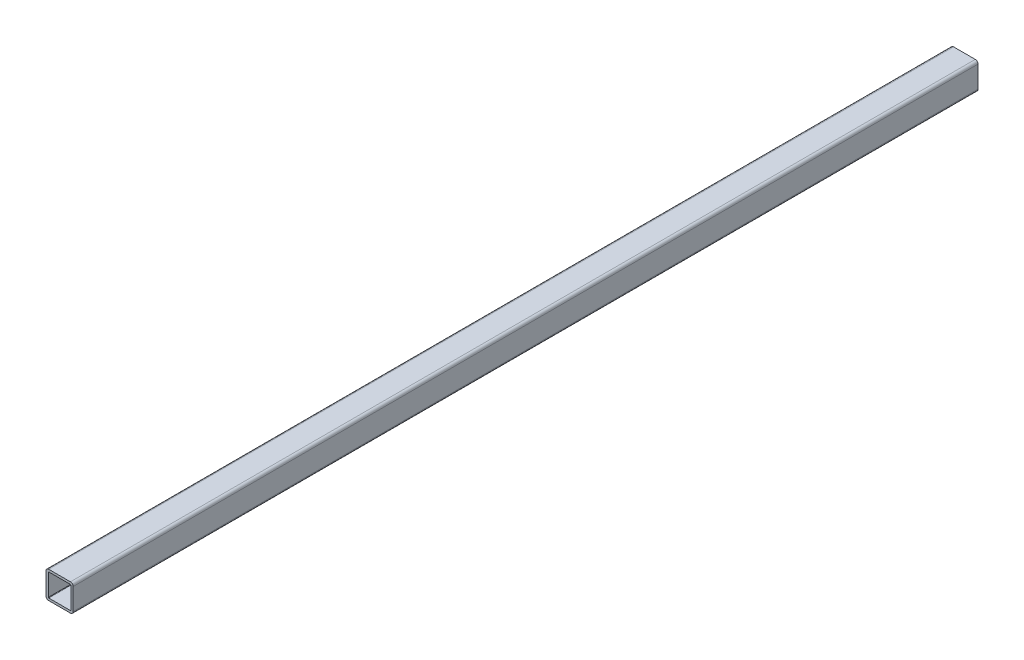
from build123d import *

# Parameters (mm, degrees)
SKETCH2_W           = 19.05
SKETCH2_H           = 19.05
SKETCH2_W_2         = 15.875
SKETCH2_H_2         = 15.875
BOSS_EXTRUDE1_DEPTH = 317.5
FILLET1_R           = 1.905
FILLET2_R           = 0.3175


with BuildPart() as part:
    # Sketch2 → Boss-Extrude1 (new, symmetric)
    with BuildSketch(Plane.XY):
        Rectangle(SKETCH2_W, SKETCH2_H)
        Rectangle(SKETCH2_W_2, SKETCH2_H_2, mode=Mode.SUBTRACT)
    extrude(amount=BOSS_EXTRUDE1_DEPTH, both=True)

    # Fillet1
    fillet1_edges = [part.edges().sort_by_distance(p)[0] for p in [
        (-9.525, -9.525, 0),
        (-9.525, 9.525, 0),
        (9.525, -9.525, 0),
        (9.525, 9.525, 0),
    ]]
    fillet(fillet1_edges, radius=FILLET1_R)

    # Fillet2
    fillet2_edges = [part.edges().sort_by_distance(p)[0] for p in [
        (7.9375, 7.9375, 0),
        (7.9375, -7.9375, 0),
        (-7.9375, -7.9375, 0),
        (-7.9375, 7.9375, 0),
    ]]
    fillet(fillet2_edges, radius=FILLET2_R)


solid = part.part
